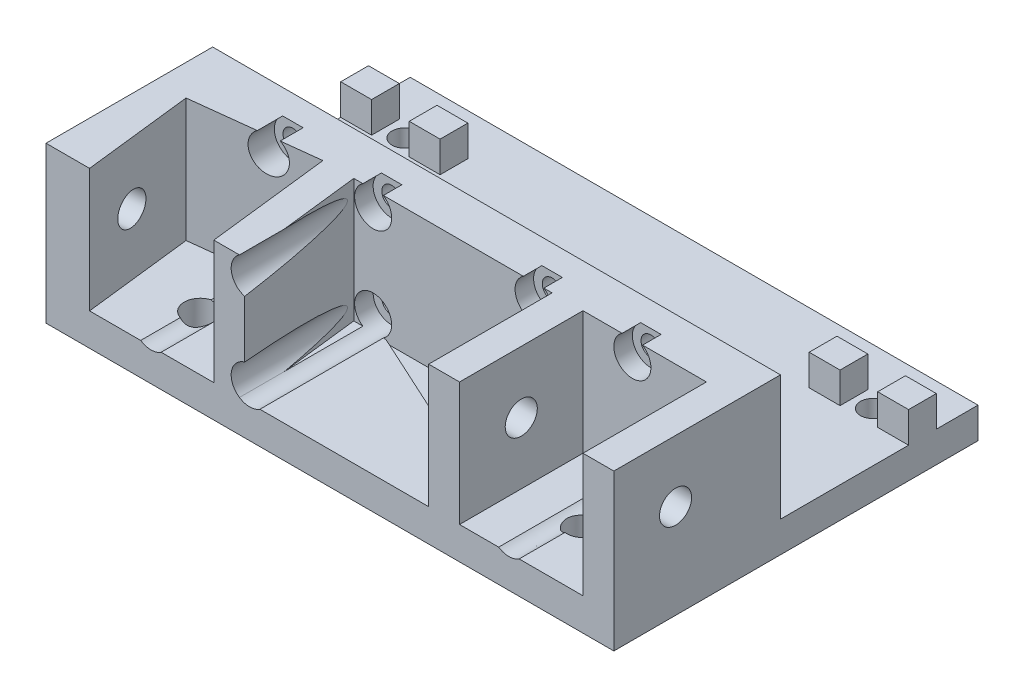
from build123d import *

# Parameters (mm, degrees)
SKETCH1_W                       = 40
SKETCH1_H                       = 20
SKETCH1_R                       = 1.6
BOSS_EXTRUDE1_DEPTH             = 7
BOSS_EXTRUDE2_DEPTH             = 5
BOSS_EXTRUDE3_DEPTH             = 5
BOSS_EXTRUDE4_DEPTH             = 0.25
SKETCH5_W                       = 50
SKETCH5_H                       = 36
BOSS_EXTRUDE5_DEPTH             = 5
SKETCH6_R                       = 3
CUT_EXTRUDE1_DEPTH              = 3
BOSS_EXTRUDE6_DEPTH             = 20
BOSS_EXTRUDE8_DEPTH             = 20
SKETCH10_R                      = 2.6
CUT_EXTRUDE2_DEPTH              = 60.779281528
BOSS_EXTRUDE9_DEPTH             = 20
SKETCH12_R                      = 2.6
CUT_EXTRUDE3_DEPTH              = 60.190898836
SKETCH13_W                      = 5
SKETCH13_H                      = 5
CUT_EXTRUDE4_DEPTH              = 6.5
CHAMFER1_SIZE                   = 15.398649638
CHAMFER1_SIZE_2                 = 10
SKETCH14_W                      = 1
SKETCH14_H                      = 20.25
CUT_EXTRUDE5_DEPTH              = 10
SKETCH16_W                      = 4
SKETCH16_H                      = 20.25
CUT_EXTRUDE7_DEPTH              = 10
BOSS_EXTRUDE10_DEPTH            = 4.75
SKETCH18_W                      = 70
SKETCH18_H                      = 5
BOSS_EXTRUDE11_DEPTH            = 3
SKETCH19_W                      = 27.635095591
SKETCH19_H                      = 22.859442667
CUT_EXTRUDE8_DEPTH              = 10
SKETCH20_R                      = 1.6
BOSS_EXTRUDE12_DEPTH            = 7
SKETCH21_R                      = 1.6
CUT_EXTRUDE9_DEPTH              = 10
BOSS_EXTRUDE13_DEPTH            = 20
BOSS_EXTRUDE16_DEPTH            = 5.25
CUT_EXTRUDE10_REACH             = 81.01
SKETCH24_R                      = 3
CUT_EXTRUDE10_DIRECTION_2_DEPTH = 30
SKETCH25_R                      = 2.6
CUT_EXTRUDE11_DEPTH             = 13
SKETCH26_R                      = 2.6
CUT_EXTRUDE12_DEPTH             = 13
SKETCH27_W                      = 22
SKETCH27_H                      = 5
BOSS_EXTRUDE17_DEPTH            = 32
BOSS_EXTRUDE7_DEPTH             = 5
SKETCH15_R                      = 2
CUT_EXTRUDE6_DEPTH              = 10


with BuildPart() as part:
    # Sketch1 → Boss-Extrude1 (new body)
    with BuildSketch(Plane.XY):
        Rectangle(SKETCH1_W, SKETCH1_H)
        with Locations((-8, 7.5)):
            Circle(SKETCH1_R, mode=Mode.SUBTRACT)
        with Locations((8, 7.5)):
            Circle(SKETCH1_R, mode=Mode.SUBTRACT)
        with Locations((8, -7.5)):
            Circle(SKETCH1_R, mode=Mode.SUBTRACT)
        with Locations((-8, -7.5)):
            Circle(SKETCH1_R, mode=Mode.SUBTRACT)
    extrude(amount=BOSS_EXTRUDE1_DEPTH)

    # Sketch2 → Boss-Extrude2 (add)
    with BuildSketch(Plane(origin=(20, 0, 0), x_dir=(0, 0, -1), z_dir=(1, 0, 0))):
        Polygon((3, -5), (3, 5), (9.5, 5), (9.5, 10), (0, 10), (-7, 10), (-7, -10), (0, -10), (9.5, -10), (9.5, -5), align=None)
    extrude(amount=BOSS_EXTRUDE2_DEPTH)

    # Sketch3 → Boss-Extrude3 (add)
    with BuildSketch(Plane.ZY.offset(20)):
        Polygon((7, 10), (-9.5, 10), (-9.5, 5), (-3, 5), (-3, -5), (-9.5, -5), (-9.5, -10), (7, -10), align=None)
    extrude(amount=BOSS_EXTRUDE3_DEPTH)

    # Sketch4 → Boss-Extrude4 (add)
    with BuildSketch(Plane.XZ.offset(10)):
        Polygon((-25, 7), (-25, -9.5), (-20, -9.5), (-20, 0), (20, 0), (20, -9.5), (25, -9.5), (25, 7), align=None)
    extrude(amount=BOSS_EXTRUDE4_DEPTH)

    # Sketch5 → Boss-Extrude5 (add)
    with BuildSketch(Plane.XZ.offset(10.25)):
        with Locations((0, -11)):
            Rectangle(SKETCH5_W, SKETCH5_H)
    extrude(amount=BOSS_EXTRUDE5_DEPTH)

    # Sketch6 → Cut-Extrude1 (cut)
    with BuildSketch(Plane.XY.offset(7)):
        with Locations((-8, 7.5)):
            Circle(SKETCH6_R)
        with Locations((-8, -7.5)):
            Circle(SKETCH6_R)
        with Locations((8, -7.5)):
            Circle(SKETCH6_R)
        with Locations((8, 7.5)):
            Circle(SKETCH6_R)
    extrude(amount=-CUT_EXTRUDE1_DEPTH, mode=Mode.SUBTRACT)

    # Sketch7 → Boss-Extrude6 (add)
    with BuildSketch(Plane.ZY.offset(25)):
        Polygon((-3, -5), (7, -5), (7, -15.25), (-29, -15.25), (-29, -10.25), (-9.5, -10.25), (-9.5, -5), align=None)
    extrude(amount=BOSS_EXTRUDE6_DEPTH)

    # Sketch9 → Boss-Extrude8 (add)
    with BuildSketch(Plane.XY.offset(7)):
        Polygon((0, 0), (0, 10), (-5, 10), (-5, -10), (0, -10), align=None)
        Polygon((20, 0), (20, 10), (25, 10), (25, -10), (20, -10), align=None)
    extrude(amount=BOSS_EXTRUDE8_DEPTH)

    # Sketch10 → Cut-Extrude2 (cut, through all)
    with BuildSketch(Plane.ZY.offset(25)):
        with Locations(Location((17, 0, 0), (0, 0, 270))):
            Circle(SKETCH10_R)
    extrude(amount=-CUT_EXTRUDE2_DEPTH, mode=Mode.SUBTRACT)

    # Sketch11 → Boss-Extrude9 (add, through all)
    with BuildSketch(Plane.XY.offset(7)):
        with BuildLine():
            Line((25, -15.25), (25, -10))
            Line((25, -10), (10, -10))
            Line((10, -10), (9.658312395, -10))
            add(Edge.make_bspline(
                [(9.658312395, -10), (9.104622692, -10.372271133), (7.89971927, -10.67517784), (6.757134286, -10.276593696), (6.341687605, -10)],
                knots=[0, 0, 0, 0, 0.571533916, 1, 1, 1, 1], degree=3))
            Line((6.341687605, -10), (-5, -10))
            Line((-5, -10), (-5, -15.25))
            Line((-5, -15.25), (25, -15.25))
        make_face()
    extrude(amount=BOSS_EXTRUDE9_DEPTH)

    # Sketch12 → Cut-Extrude3 (cut, through all)
    with BuildSketch(Plane.XZ.offset(15.25)):
        with Locations(Location((10, 17, 0), (0, 0, 270))):
            Circle(SKETCH12_R)
    extrude(amount=-CUT_EXTRUDE3_DEPTH, mode=Mode.SUBTRACT)

    # Sketch13 → Cut-Extrude4 (cut)
    with BuildSketch(Plane(origin=(0, 0, -9.5), x_dir=(-1, 0, 0), z_dir=(0, 0, -1))):
        with Locations((22.5, 7.5)):
            Rectangle(SKETCH13_W, SKETCH13_H)
        with Locations((-22.5, 7.5)):
            Rectangle(SKETCH13_W, SKETCH13_H)
    extrude(amount=-CUT_EXTRUDE4_DEPTH, mode=Mode.SUBTRACT)

    # Chamfer1
    # the kernel refuses this chamfer: 15.398649638, 10 mm, written as the material it adds along each edge
    with BuildSketch(Plane(origin=(-25, -5, 7), x_dir=(0.021073765466273167, 0.9997779235455604, 0), z_dir=(0, 0, -1))) as chamfer1_piece_1_section:
        Polygon((CHAMFER1_SIZE * 0.999777923555, -CHAMFER1_SIZE * 0.0210737654665), (-CHAMFER1_SIZE_2 * 0.0210737654663, -CHAMFER1_SIZE_2 * 0.999777923546), (0, 0), align=None)
    chamfer1_piece_1 = extrude(amount=10, mode=Mode.PRIVATE)
    chamfer1_piece_1 = split(chamfer1_piece_1, bisect_by=Plane(origin=(-28.252881362, 10, 2), z_dir=(0, -1, 0)), keep=Keep.TOP, mode=Mode.PRIVATE)
    add(chamfer1_piece_1)

    # Sketch14 → Cut-Extrude5 (cut)
    with BuildSketch(Plane(origin=(0, 0, 0), x_dir=(-1, 0, 0), z_dir=(0, 0, -1))):
        with Locations((20.5, -0.125)):
            Rectangle(SKETCH14_W, SKETCH14_H)
        with Locations((-20.5, -0.125)):
            Rectangle(SKETCH14_W, SKETCH14_H)
    extrude(amount=CUT_EXTRUDE5_DEPTH, mode=Mode.SUBTRACT)

    # Sketch16 → Cut-Extrude7 (cut)
    with BuildSketch(Plane(origin=(0, 0, 0), x_dir=(-1, 0, 0), z_dir=(0, 0, -1))):
        with Locations((-23, -0.125)):
            Rectangle(SKETCH16_W, SKETCH16_H)
    extrude(amount=CUT_EXTRUDE7_DEPTH, mode=Mode.SUBTRACT)

    # Sketch17 → Boss-Extrude10 (add)
    with BuildSketch(Plane.XZ.offset(15.25)):
        Polygon((-5, 27), (-45, 7), (-5, 7), align=None)
    extrude(amount=-BOSS_EXTRUDE10_DEPTH)

    # Sketch18 → Boss-Extrude11 (add)
    with BuildSketch(Plane(origin=(0, 0, -29), x_dir=(-1, 0, 0), z_dir=(0, 0, -1))):
        with Locations((10, -12.75)):
            Rectangle(SKETCH18_W, SKETCH18_H)
    extrude(amount=BOSS_EXTRUDE11_DEPTH)

    # Sketch19 → Cut-Extrude8 (cut)
    with BuildSketch(Plane(origin=(0, 0, 0), x_dir=(-1, 0, 0), z_dir=(0, 0, -1))):
        with Locations((34.817547796, 1.179721334)):
            Rectangle(SKETCH19_W, SKETCH19_H)
    extrude(amount=CUT_EXTRUDE8_DEPTH, mode=Mode.SUBTRACT)

    # Sketch20 → Boss-Extrude12 (add)
    with BuildSketch(Plane(origin=(0, 0, 0), x_dir=(-1, 0, 0), z_dir=(0, 0, -1))):
        Polygon((25.258886102, 10), (67, 10), (67, -15.25), (45, -15.25), (25.258886102, -15.25), align=None)
        with Locations((34, 7.5)):
            Circle(SKETCH20_R, mode=Mode.SUBTRACT)
        with Locations((50, 7.5)):
            Circle(SKETCH20_R, mode=Mode.SUBTRACT)
        with Locations((50, -7.5)):
            Circle(SKETCH20_R, mode=Mode.SUBTRACT)
        with Locations((34, -7.5)):
            Circle(SKETCH20_R, mode=Mode.SUBTRACT)
    extrude(amount=-BOSS_EXTRUDE12_DEPTH)

    # Sketch21 → Cut-Extrude9 (cut)
    with BuildSketch(Plane(origin=(0, 0, 0), x_dir=(-1, 0, 0), z_dir=(0, 0, -1))):
        with Locations((34, -7.5)):
            Circle(SKETCH21_R)
    extrude(amount=-CUT_EXTRUDE9_DEPTH, mode=Mode.SUBTRACT)

    # Sketch22 → Boss-Extrude13 (add)
    with BuildSketch(Plane(origin=(0, -10, 0), x_dir=(1, 0, 0), z_dir=(0, 1, 0))):
        Polygon((-34.808886143, -27), (-37.133773289, -7), (-42.133773289, -7), (-39.808886143, -27), align=None)
        Polygon((-62, -27), (-59.943560221, -27), (-62, -9.309336755), (-42.133773289, -7), (-62, -7), (-67, -7), (-67, -27), align=None)
    extrude(amount=BOSS_EXTRUDE13_DEPTH)

    # Sketch23 → Boss-Extrude16 (add)
    with BuildSketch(Plane.XZ.offset(15.25)):
        Polygon((-5, 27), (-67, 27), (-67, 7), (-38.677443382, 3.903576174), (-3.502938693, 20.047771916), align=None)
    extrude(amount=-BOSS_EXTRUDE16_DEPTH)

    # Cut-Extrude10: up to this face of the body (flat: up to its plane)
    cut_extrude10_end = Plane(part.part.faces().sort_by_distance((-8, 9.918605897, 4))[0])
    # Sketch24 → Cut-Extrude10 (cut, up to the picked face)
    with BuildSketch(Plane.XY.offset(7), mode=Mode.PRIVATE) as cut_extrude10_sk1:
        with Locations((-34, 7.5)):
            Circle(SKETCH24_R)
    cut_extrude10_tool1 = split(extrude(cut_extrude10_sk1.sketch, amount=-CUT_EXTRUDE10_REACH, mode=Mode.PRIVATE), bisect_by=cut_extrude10_end, keep=Keep.BOTH, mode=Mode.PRIVATE)
    # Sketch24 → Cut-Extrude10 (cut, up to the picked face)
    with BuildSketch(Plane.XY.offset(7), mode=Mode.PRIVATE) as cut_extrude10_sk2:
        with Locations((-50, 7.5)):
            Circle(SKETCH24_R)
    cut_extrude10_tool2 = split(extrude(cut_extrude10_sk2.sketch, amount=-CUT_EXTRUDE10_REACH, mode=Mode.PRIVATE), bisect_by=cut_extrude10_end, keep=Keep.BOTH, mode=Mode.PRIVATE)
    # Sketch24 → Cut-Extrude10 (cut, up to the picked face)
    with BuildSketch(Plane.XY.offset(7), mode=Mode.PRIVATE) as cut_extrude10_sk3:
        with Locations(Location((-50, -7.5, 0), (0, 0, 236.442690238))):
            Circle(SKETCH24_R)
    cut_extrude10_tool3 = split(extrude(cut_extrude10_sk3.sketch, amount=-CUT_EXTRUDE10_REACH, mode=Mode.PRIVATE), bisect_by=cut_extrude10_end, keep=Keep.BOTH, mode=Mode.PRIVATE)
    # Sketch24 → Cut-Extrude10 (cut, up to the picked face)
    with BuildSketch(Plane.XY.offset(7), mode=Mode.PRIVATE) as cut_extrude10_sk4:
        with Locations(Location((-34, -7.5, 0), (0, 0, 236.442690238))):
            Circle(SKETCH24_R)
    cut_extrude10_tool4 = split(extrude(cut_extrude10_sk4.sketch, amount=-CUT_EXTRUDE10_REACH, mode=Mode.PRIVATE), bisect_by=cut_extrude10_end, keep=Keep.BOTH, mode=Mode.PRIVATE)
    add(cut_extrude10_tool1.solids().sort_by(Axis((-34, 7.5, 7), (0, 0, -1)))[0], mode=Mode.SUBTRACT)
    add(cut_extrude10_tool2.solids().sort_by(Axis((-50, 7.5, 7), (0, 0, -1)))[0], mode=Mode.SUBTRACT)
    add(cut_extrude10_tool3.solids().sort_by(Axis((-50, -7.5, 7), (0, 0, -1)))[0], mode=Mode.SUBTRACT)
    add(cut_extrude10_tool4.solids().sort_by(Axis((-34, -7.5, 7), (0, 0, -1)))[0], mode=Mode.SUBTRACT)

    # Sketch24 → Cut-Extrude10 direction 2 (cut)
    with BuildSketch(Plane.XY.offset(7)):
        with Locations((-34, 7.5)):
            Circle(SKETCH24_R)
        with Locations((-50, 7.5)):
            Circle(SKETCH24_R)
        with Locations(Location((-50, -7.5, 0), (0, 0, 236.442690238))):
            Circle(SKETCH24_R)
        with Locations(Location((-34, -7.5, 0), (0, 0, 236.442690238))):
            Circle(SKETCH24_R)
    extrude(amount=CUT_EXTRUDE10_DIRECTION_2_DEPTH, mode=Mode.SUBTRACT)

    # Sketch25 → Cut-Extrude11 (cut)
    with BuildSketch(Plane(origin=(0, -10, 0), x_dir=(1, 0, 0), z_dir=(0, 1, 0))):
        with Locations(Location((-50.912218267, -18.087781733, 0), (0, 0, 253.32400016))):
            Circle(SKETCH25_R)
    extrude(amount=-CUT_EXTRUDE11_DEPTH, mode=Mode.SUBTRACT)

    # Sketch26 → Cut-Extrude12 (cut)
    with BuildSketch(Plane(origin=(-62.241109281, 0, 7.235177744), x_dir=(-0.11546683777049035, 0, -0.9933113355717247), z_dir=(0.9933113355717246, 0, -0.11546683777049034))):
        with Locations((-12.088125784, 0)):
            Circle(SKETCH26_R)
    extrude(amount=-CUT_EXTRUDE12_DEPTH, mode=Mode.SUBTRACT)

    # Sketch27 → Boss-Extrude17 (add)
    with BuildSketch(Plane(origin=(0, 0, 0), x_dir=(-1, 0, 0), z_dir=(0, 0, -1))):
        with Locations((56, -12.75)):
            Rectangle(SKETCH27_W, SKETCH27_H)
    extrude(amount=BOSS_EXTRUDE17_DEPTH)

    # Sketch8 → Boss-Extrude7 (add)
    with BuildSketch(Plane(origin=(0, -10.25, 0), x_dir=(1, 0, 0), z_dir=(0, 1, 0))):
        Polygon((20, 20.75), (20, 25.25), (25, 25.25), (25, 20.75), (22, 20.75), align=None)
        Polygon((13.9, 23), (13.9, 20.75), (11.9, 20.75), (8.9, 20.75), (8.9, 25.25), (13.9, 25.25), align=None)
        Polygon((-50.9, 20.75), (-50.9, 25.25), (-55.9, 25.25), (-55.9, 23), (-55.9, 20.75), (-53.9, 20.75), align=None)
        Polygon((-67, 20.75), (-64, 20.75), (-62, 20.75), (-62, 25.25), (-67, 25.25), align=None)
    extrude(amount=BOSS_EXTRUDE7_DEPTH)

    # Sketch15 → Cut-Extrude6 (cut)
    with BuildSketch(Plane(origin=(0, -10.25, 0), x_dir=(1, 0, 0), z_dir=(0, 1, 0))):
        with Locations(Location((16.95, 23, 0), (0, 0, 270))):
            Circle(SKETCH15_R)
        with Locations(Location((-58.95, 23, 0), (0, 0, 270))):
            Circle(SKETCH15_R)
    extrude(amount=-CUT_EXTRUDE6_DEPTH, mode=Mode.SUBTRACT)


solid = part.part
